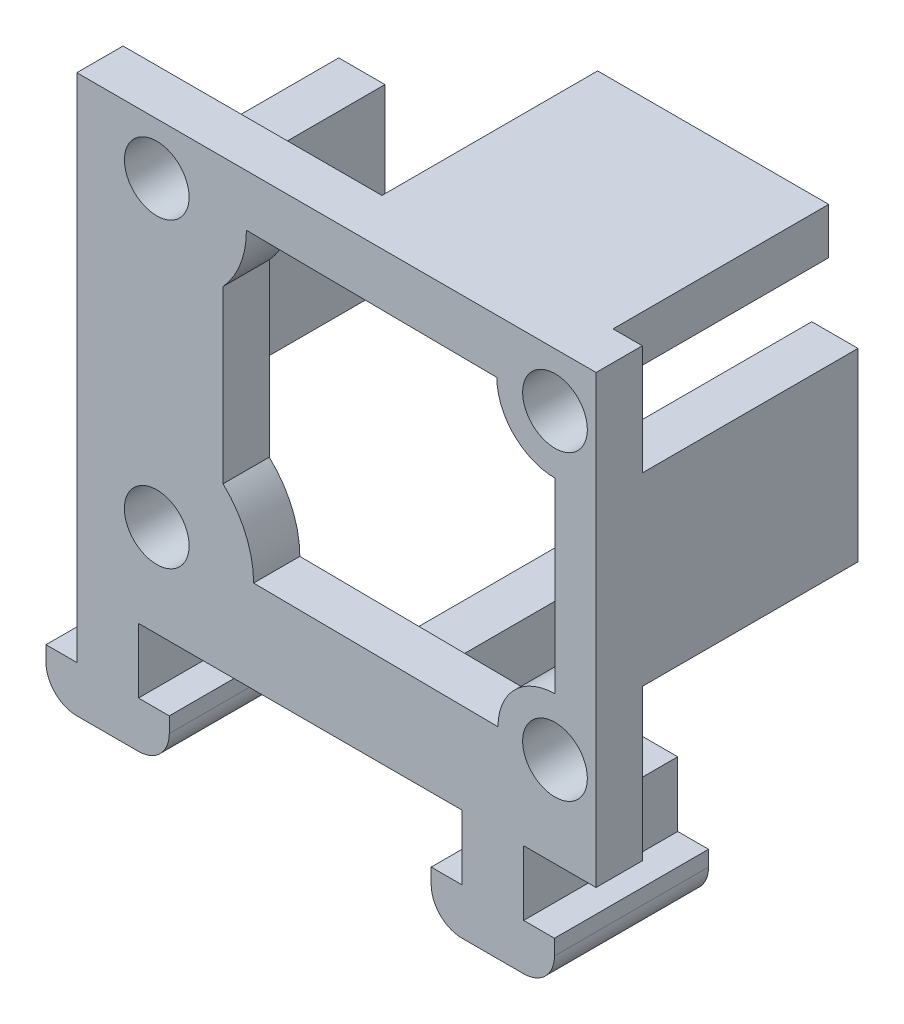
from build123d import *

# Parameters (mm, degrees)
EXTRUDE_1_DEPTH      = 2
EXTRUDE_1_DEPTH_BACK = 1
SKETCH_2_R           = 2.1
SKETCH_10_W          = 15
SKETCH_10_H          = 3
SKETCH_10_W_2        = 3
SKETCH_10_H_2        = 12
SKETCH_10_H_3        = 11.479623975
EXTRUDE_4_DEPTH      = 14
BOSS_EXTRUDE1_DEPTH  = 10
LPATTERN1_COUNT      = 2
LPATTERN1_PITCH      = 25
SKETCH2_W            = 3
SKETCH2_H            = 4
BOSS_EXTRUDE2_DEPTH  = 14
BOSS_EXTRUDE3_DEPTH  = 4
LPATTERN2_COUNT      = 2
LPATTERN2_PITCH      = 25


with BuildPart() as part:
    # Эскиз2 → Бобышка-Вытянуть1 (new, two sides: drawn at the far end of the back side and taken through both)
    with BuildSketch(Plane.XY.offset(-EXTRUDE_1_DEPTH_BACK)):
        Polygon((-9.490571092, 0), (-9.490571092, -2.25), (24.209428908, -2.25), (24.209428908, 0), (24.209428908, 26.7), (-9.490571092, 26.7), align=None)
        with Locations((21.543854112, 3.601530827)):
            Circle(SKETCH_2_R, mode=Mode.SUBTRACT)
        with Locations((21.543854112, 23.201353662)):
            Circle(SKETCH_2_R, mode=Mode.SUBTRACT)
        with Locations((-4.303927329, 23.347253317)):
            Circle(SKETCH_2_R, mode=Mode.SUBTRACT)
        with Locations((-4.303927329, 3.749999419)):
            Circle(SKETCH_2_R, mode=Mode.SUBTRACT)
        with BuildLine():
            Line((0, 19.427331525), (0, 8.33481378))
            ThreePointArc((0, 8.33481378), (1.467088425, 6.247936636), (1.984499595, 3.749999419))
            Line((1.984499595, 3.749999419), (17.842433275, 3.601530827))
            ThreePointArc((17.842433275, 3.601530827), (18.926554338, 6.218830601), (21.543854112, 7.302951664))
            Line((21.543854112, 7.302951664), (21.543854112, 19.427331525))
            ThreePointArc((21.543854112, 19.427331525), (18.875217467, 20.532717016), (17.769831975, 23.201353662))
            Line((17.769831975, 23.201353662), (1.517548198, 23.347253317))
            ThreePointArc((1.517548198, 23.347253317), (1.124920842, 21.245543335), (0, 19.427331525))
        make_face(mode=Mode.SUBTRACT)
    extrude(amount=EXTRUDE_1_DEPTH + EXTRUDE_1_DEPTH_BACK)

    # Эскиз10 → Бобышка-Вытянуть4 (add)
    with BuildSketch(Plane(origin=(0, 0, -1), x_dir=(-1, 0, 0), z_dir=(0, 0, -1))):
        with Locations((-14.81045997, 25.2)):
            Rectangle(SKETCH_10_W, SKETCH_10_H)
        with Locations((-22.709428908, 13.552877761)):
            Rectangle(SKETCH_10_W_2, SKETCH_10_H_2)
        with Locations((7.990571092, 13.292689749)):
            Rectangle(SKETCH_10_W_2, SKETCH_10_H_3)
    extrude(amount=EXTRUDE_4_DEPTH)

    # Sketch1 → Boss-Extrude1 (add)
    with BuildSketch(Plane.XY.offset(2)):
        with BuildLine():
            Line((-3.490571092, -6.45), (-5.490571092, -6.45))
            Line((-5.490571092, -6.45), (-5.490571092, -2.25))
            Line((-5.490571092, -2.25), (-9.490571092, -2.25))
            Line((-9.490571092, -2.25), (-9.490571092, -6.45))
            Line((-9.490571092, -6.45), (-11.490571092, -6.45))
            Line((-11.490571092, -6.45), (-11.490571092, -7.45))
            ThreePointArc((-11.490571092, -7.45), (-10.904784654, -8.864213562), (-9.490571092, -9.45))
            Line((-9.490571092, -9.45), (-5.490571092, -9.45))
            ThreePointArc((-5.490571092, -9.45), (-4.07635753, -8.864213562), (-3.490571092, -7.45))
            Line((-3.490571092, -7.45), (-3.490571092, -6.45))
        make_face()
    boss_extrude1 = extrude(amount=-BOSS_EXTRUDE1_DEPTH)

    # LPattern1: Boss-Extrude1 ×2
    with Locations(*[(i * LPATTERN1_PITCH, 0, 0) for i in range(1, LPATTERN1_COUNT)]):
        add(boss_extrude1)

    # Sketch2 → Boss-Extrude2 (add)
    with BuildSketch(Plane(origin=(0, 0, -1), x_dir=(-1, 0, 0), z_dir=(0, 0, -1))):
        with Locations((-9.283605158, -0.25)):
            Rectangle(SKETCH2_W, SKETCH2_H)
    extrude(amount=BOSS_EXTRUDE2_DEPTH)

    # Sketch3 → Boss-Extrude3 (add)
    with BuildSketch(Plane.ZY.offset(-15.509428908)):
        Polygon((-4.5, -2.25), (-1, -2.25), (-1, 0.558861968), align=None)
    boss_extrude3 = extrude(amount=-BOSS_EXTRUDE3_DEPTH)

    # LPattern2: Boss-Extrude3 ×2
    with Locations(*[(-i * LPATTERN2_PITCH, 0, 0) for i in range(1, LPATTERN2_COUNT)]):
        add(boss_extrude3)


solid = part.part
